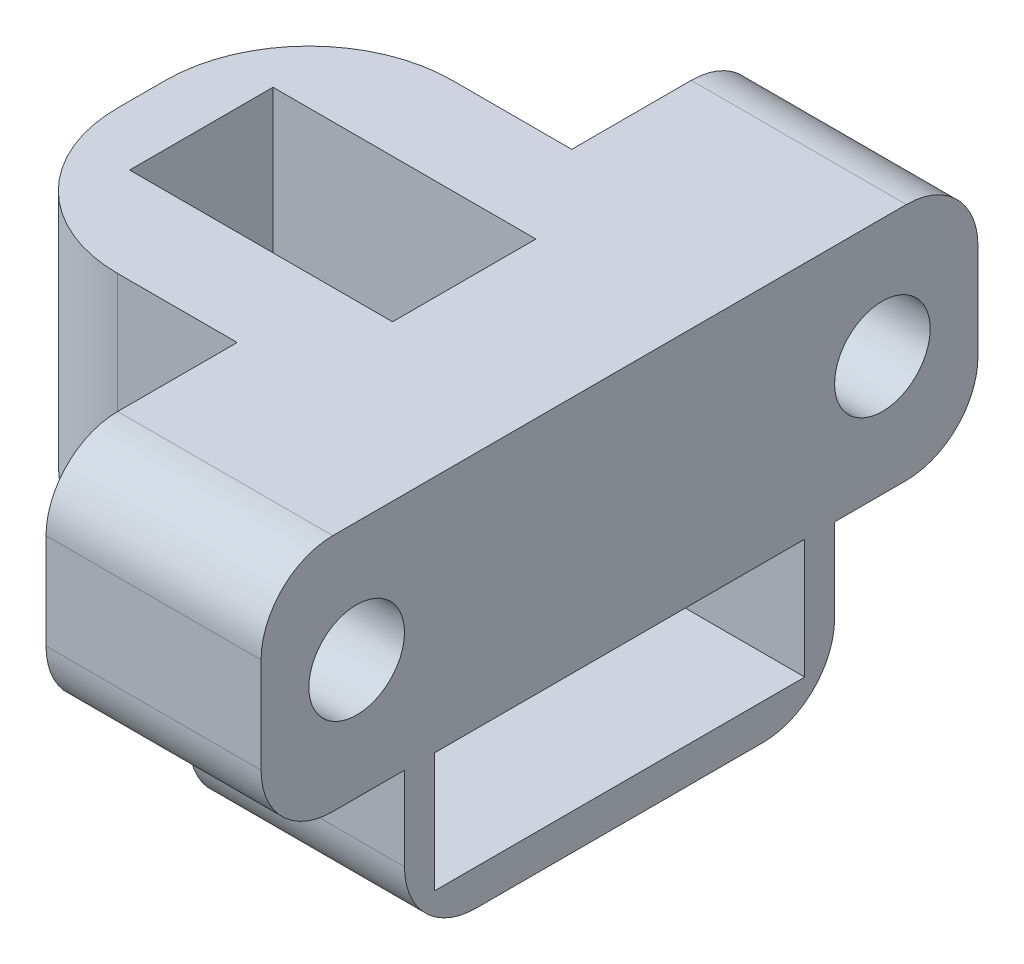
from build123d import *

# Parameters (mm, degrees)
ESBO_O1_W                = 20
ESBO_O1_H                = 30
RESSALTO_EXTRUS_O1_DEPTH = 10
ESBO_O2_W                = 11
ESBO_O2_H                = 8
CORTE_EXTRUS_O1_DEPTH    = 10
ESBO_O3_W                = 11
ESBO_O3_H                = 6
CORTE_EXTRUS_O2_DEPTH    = 7
ESBO_O4_W                = 9
ESBO_O4_H                = 18
RESSALTO_EXTRUS_O2_DEPTH = 6.5
ESBO_O5_W                = 15.5
ESBO_O5_H                = 5
CORTE_EXTRUS_O3_DEPTH    = 5.5
ESBO_O6_R                = 2
CORTE_EXTRUS_O4_DEPTH    = 22.118712082
ESBO_O7_R                = 3.5
CORTE_EXTRUS_O5_DEPTH    = 2
FILETE1_R                = 6
FILETE2_R                = 3


with BuildPart() as part:
    # Esboço1 → Ressalto-extrusão1 (new body)
    with BuildSketch(Plane(origin=(0, 0, 0), x_dir=(1, 0, 0), z_dir=(0, 1, 0))):
        Rectangle(ESBO_O1_W, ESBO_O1_H)
    extrude(amount=RESSALTO_EXTRUS_O1_DEPTH)

    # Esboço2 → Corte-extrusão1 (cut)
    with BuildSketch(Plane(origin=(0, 10, 0), x_dir=(1, 0, 0), z_dir=(0, 1, 0))):
        with Locations((-4.5, 11)):
            Rectangle(ESBO_O2_W, ESBO_O2_H)
        with Locations((-4.5, -11)):
            Rectangle(ESBO_O2_W, ESBO_O2_H)
    extrude(amount=-CORTE_EXTRUS_O1_DEPTH, mode=Mode.SUBTRACT)

    # Esboço3 → Corte-extrusão2 (cut)
    with BuildSketch(Plane(origin=(0, 10, 0), x_dir=(1, 0, 0), z_dir=(0, 1, 0))):
        with Locations((-2, 0)):
            Rectangle(ESBO_O3_W, ESBO_O3_H)
    extrude(amount=-CORTE_EXTRUS_O2_DEPTH, mode=Mode.SUBTRACT)

    # Esboço4 → Ressalto-extrusão2 (add)
    with BuildSketch(Plane.XZ):
        with Locations((5.5, 0)):
            Rectangle(ESBO_O4_W, ESBO_O4_H)
    extrude(amount=RESSALTO_EXTRUS_O2_DEPTH)

    # Esboço5 → Corte-extrusão3 (cut)
    with BuildSketch(Plane(origin=(10, 0, 0), x_dir=(0, 0, -1), z_dir=(1, 0, 0))):
        with Locations((0, -2.5)):
            Rectangle(ESBO_O5_W, ESBO_O5_H)
    extrude(amount=-CORTE_EXTRUS_O3_DEPTH, mode=Mode.SUBTRACT)

    # Esboço6 → Corte-extrusão4 (cut, through all)
    with BuildSketch(Plane.ZY.offset(-1)):
        with Locations((11, 5)):
            Circle(ESBO_O6_R)
        with Locations((-11, 5)):
            Circle(ESBO_O6_R)
    extrude(amount=-CORTE_EXTRUS_O4_DEPTH, mode=Mode.SUBTRACT)

    # Esboço7 → Corte-extrusão5 (cut)
    with BuildSketch(Plane.ZY.offset(-1)):
        with Locations((11, 5)):
            Circle(ESBO_O7_R)
        with Locations((-11, 5)):
            Circle(ESBO_O7_R)
    extrude(amount=-CORTE_EXTRUS_O5_DEPTH, mode=Mode.SUBTRACT)

    # Filete1
    filete1_edges = [part.edges().sort_by_distance(p)[0] for p in [
        (-10, 5, -7),
        (-10, 5, 7),
    ]]
    fillet(filete1_edges, radius=FILETE1_R)

    # Filete2
    filete2_edges = [part.edges().sort_by_distance(p)[0] for p in [
        (5.5, 10, 15),
        (5.5, 10, -15),
        (5.5, 0, -15),
        (5.5, 0, 15),
        (5.5, -6.5, 9),
        (5.5, -6.5, -9),
    ]]
    fillet(filete2_edges, radius=FILETE2_R)


solid = part.part
